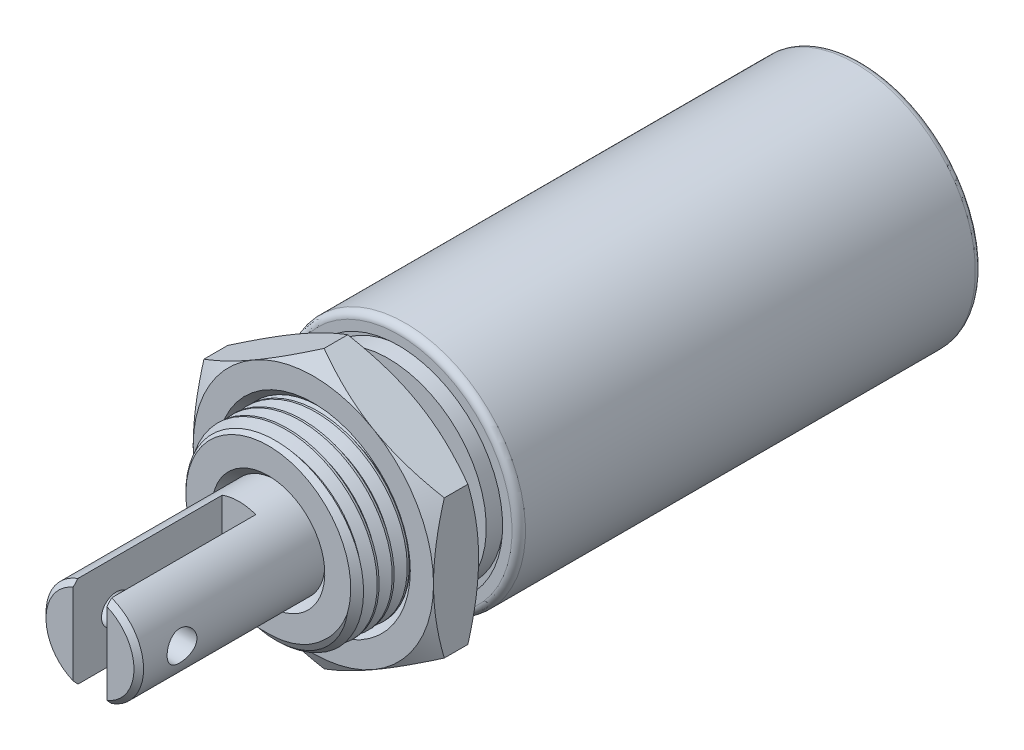
from build123d import *

# Parameters (mm, degrees)
CUT_EXTRUDE1_REACH                  = 28.701
CUT_EXTRUDE1_END_RADIUS             = 2.5781
SKETCH4_W                           = 7.874
SKETCH4_H                           = 1.778
CUT_EXTRUDE1_DIRECTION_2_REACH      = 28.701
CUT_EXTRUDE1_DIRECTION_2_END_RADIUS = 2.5781
CUT_EXTRUDE2_REACH                  = 28.701
CUT_EXTRUDE2_END_RADIUS             = 2.5781
SKETCH5_R                           = 0.7874
CUT_EXTRUDE2_DIRECTION_2_REACH      = 28.701
CUT_EXTRUDE2_DIRECTION_2_END_RADIUS = 2.5781
BOSS_EXTRUDE3_START                 = 1.5875
SKETCH10_R                          = 4.7625
BOSS_EXTRUDE3_DEPTH                 = 2.38125
CUT_SWEEP1_PITCH                    = 0.79375


with BuildPart() as part:
    # Sketch1 → Revolve1 (revolve)
    with BuildSketch(Plane(origin=(0, 0, 0), x_dir=(0, 0, -1), z_dir=(1, 0, 0)), mode=Mode.PRIVATE) as revolve1_sk:
        with BuildLine():
            Line((24.6634, 6.35), (0.889, 6.35))
            ThreePointArc((0.889, 6.35), (0.637552829, 6.245847171), (0.5334, 5.9944))
            Line((0.5334, 5.9944), (0.5334, 5.4991))
            Line((0.5334, 5.4991), (0.9144, 5.4991))
            Line((0.9144, 5.4991), (0.9144, 5.1689))
            Line((0.9144, 5.1689), (0, 5.1689))
            Line((0, 5.1689), (0, 0))
            Line((0, 0), (25.146, 0))
            Line((25.146, 0), (25.146, 2.7432))
            ThreePointArc((25.146, 2.7432), (25.108802561, 2.833002561), (25.019, 2.8702))
            Line((25.019, 2.8702), (25.019, 5.9944))
            ThreePointArc((25.019, 5.9944), (24.914847171, 6.245847171), (24.6634, 6.35))
        make_face()
    revolve(revolve1_sk.sketch.rotate(Axis((0, 0, -25.146), (0, 0, 1)), 90), axis=Axis((0, 0, -25.146), (0, 0, 1)))

    # Sketch2 → Revolve2 (revolve)
    with BuildSketch(Plane(origin=(0, 0, 0), x_dir=(0, 0, -1), z_dir=(1, 0, 0))):
        Polygon((-6.35, 2.9845), (-6.35, 4.3561), (-5.9436, 4.7625), (-1.273939151, 4.7625), (-0.8382, 4.1402), (0, 4.1402), (0, 2.5781), (-5.9436, 2.5781), align=None)
    revolve(axis=Axis((0, 0, 0), (0, 0, 1)))

    # Cut-Sweep1: the profile of Sketch7 screwed along a right-hand helix of 7.944 turns, 8 arcs to a turn; built about Z, then put on its axis
    cut_sweep1_z = Axis((0, 0, 0), (0, 0, 1))
    cut_sweep1_corners = [(4.246944252, 0, -0.396875), (4.246944252, 0, -0.29765625), (4.805462979, 0, 0.024804688), (4.805462979, 0, -0.719335938)]
    with BuildLine(mode=Mode.PRIVATE) as cut_sweep1_profile:
        Line(cut_sweep1_corners[0], cut_sweep1_corners[1])
        Line(cut_sweep1_corners[1], cut_sweep1_corners[2])
        Line(cut_sweep1_corners[2], cut_sweep1_corners[3])
        Line(cut_sweep1_corners[3], cut_sweep1_corners[0])
    cut_sweep1_cap = Face(cut_sweep1_profile.wire())
    cut_sweep1_turn_angles = [0, 22.5, 45, 67.5, 90, 112.5, 135, 157.5, 180, 202.5, 225, 247.5, 270, 292.5, 315, 337.5, 360]
    cut_sweep1_turn_weights = [1, 0.9238795325112867, 1, 0.9238795325112867, 1, 0.9238795325112867, 1, 0.9238795325112867, 1, 0.9238795325112867, 1, 0.9238795325112867, 1, 0.9238795325112867, 1, 0.9238795325112867, 1]
    cut_sweep1_turn_rails = [Edge.make_bspline([Vector(p[0], p[1], 0).rotate(cut_sweep1_z, cut_sweep1_turn_angles[k]) / cut_sweep1_turn_weights[k] + Vector(0, 0, p[2] + CUT_SWEEP1_PITCH * cut_sweep1_turn_angles[k] / 360) for k in range(17)], [0, 0, 0, 1, 1, 2, 2, 3, 3, 4, 4, 5, 5, 6, 6, 7, 7, 8, 8, 8], 2, cut_sweep1_turn_weights) for p in cut_sweep1_corners]
    cut_sweep1_turn_sides = [Face.make_surface_from_curves(cut_sweep1_turn_rails[p[0]], cut_sweep1_turn_rails[p[1]]) for p in [(0, 1), (1, 2), (2, 3), (3, 0)]]
    cut_sweep1_last_angles = [2520, 2542.5, 2565, 2587.5, 2610, 2632.5, 2655, 2677.5, 2700, 2722.5, 2745, 2767.5, 2790, 2812.5, 2835, 2847.42, 2859.84]
    cut_sweep1_last_weights = [1, 0.9238795325112867, 1, 0.9238795325112867, 1, 0.9238795325112867, 1, 0.9238795325112867, 1, 0.9238795325112867, 1, 0.9238795325112867, 1, 0.9238795325112867, 1, 0.976597262063785, 1]
    cut_sweep1_last_rails = [Edge.make_bspline([Vector(p[0], p[1], 0).rotate(cut_sweep1_z, cut_sweep1_last_angles[k]) / cut_sweep1_last_weights[k] + Vector(0, 0, p[2] + CUT_SWEEP1_PITCH * cut_sweep1_last_angles[k] / 360) for k in range(17)], [0, 0, 0, 1, 1, 2, 2, 3, 3, 4, 4, 5, 5, 6, 6, 7, 7, 8, 8, 8], 2, cut_sweep1_last_weights) for p in cut_sweep1_corners]
    cut_sweep1_last_sides = [Face.make_surface_from_curves(cut_sweep1_last_rails[p[0]], cut_sweep1_last_rails[p[1]]) for p in [(0, 1), (1, 2), (2, 3), (3, 0)]]
    cut_sweep1 = Plane(origin=(0, 0, 6.35), x_dir=(0, 1, 0), z_dir=(0, 0, -1)) * Solid(Shell([*[p.moved(Location((0, 0, CUT_SWEEP1_PITCH * i))) for i in range(7) for p in cut_sweep1_turn_sides], *cut_sweep1_last_sides, cut_sweep1_cap, cut_sweep1_cap.rotate(cut_sweep1_z, 2859.84).moved(Location((0, 0, CUT_SWEEP1_PITCH * 2859.84 / 360)))]))
    add(cut_sweep1, mode=Mode.SUBTRACT)


with BuildPart() as body_2:
    # Sketch3 → Revolve3 (revolve)
    with BuildSketch(Plane(origin=(0, 0, 0), x_dir=(0, 0, -1), z_dir=(1, 0, 0))):
        Polygon((-15.5194, 2.5781), (-15.7734, 2.3241), (-15.7734, 0), (0, 0), (0, 2.5781), align=None)
    revolve(axis=Axis((0, 0, 0), (0, 0, 1)))

    # Cut-Extrude1: up to this cylinder (the profile starts inside it)
    cut_extrude1_end = Plane(origin=(0, 0, 11.8364), z_dir=(0, 0, -1)) * Cylinder(CUT_EXTRUDE1_END_RADIUS, 63.5582, mode=Mode.PRIVATE)
    # Sketch4 → Cut-Extrude1 (cut, up to the surface)
    with BuildSketch(Plane(origin=(0, 0, 0), x_dir=(0, 0, -1), z_dir=(0, 1, 0)), mode=Mode.PRIVATE) as cut_extrude1_sk1:
        with Locations((-11.8364, 0)):
            Rectangle(SKETCH4_W, SKETCH4_H)
    cut_extrude1_tool1 = extrude(cut_extrude1_sk1.sketch, amount=-CUT_EXTRUDE1_REACH, mode=Mode.PRIVATE) & cut_extrude1_end
    add(cut_extrude1_tool1.solids().sort_by_distance((0, 0, 11.8364))[0], mode=Mode.SUBTRACT)

    # Cut-Extrude1 direction 2: up to this cylinder (the profile starts inside it)
    cut_extrude1_direction_2_end = Plane(origin=(0, 0, 11.8364), z_dir=(0, 0, -1)) * Cylinder(CUT_EXTRUDE1_DIRECTION_2_END_RADIUS, 63.5582, mode=Mode.PRIVATE)
    # Sketch4 → Cut-Extrude1 direction 2 (cut, up to the surface)
    with BuildSketch(Plane(origin=(0, 0, 0), x_dir=(0, 0, -1), z_dir=(0, 1, 0)), mode=Mode.PRIVATE) as cut_extrude1_direction_2_sk1:
        with Locations((-11.8364, 0)):
            Rectangle(SKETCH4_W, SKETCH4_H)
    cut_extrude1_direction_2_tool1 = extrude(cut_extrude1_direction_2_sk1.sketch, amount=CUT_EXTRUDE1_DIRECTION_2_REACH, mode=Mode.PRIVATE) & cut_extrude1_direction_2_end
    add(cut_extrude1_direction_2_tool1.solids().sort_by_distance((0, 0, 11.8364))[0], mode=Mode.SUBTRACT)

    # Cut-Extrude2: up to this cylinder (the profile starts inside it)
    cut_extrude2_end = Plane(origin=(0, 0, 13.4874), z_dir=(0, 0, -1)) * Cylinder(CUT_EXTRUDE2_END_RADIUS, 63.5582, mode=Mode.PRIVATE)
    # Sketch5 → Cut-Extrude2 (cut, up to the surface)
    with BuildSketch(Plane(origin=(0, 0, 0), x_dir=(0, -1, 0), z_dir=(1, 0, 0)), mode=Mode.PRIVATE) as cut_extrude2_sk1:
        with Locations(Location((0, -13.4874, 0), (0, 0, 270))):
            Circle(SKETCH5_R)
    cut_extrude2_tool1 = extrude(cut_extrude2_sk1.sketch, amount=CUT_EXTRUDE2_REACH, mode=Mode.PRIVATE) & cut_extrude2_end
    add(cut_extrude2_tool1.solids().sort_by_distance((0, 0, 13.4874))[0], mode=Mode.SUBTRACT)

    # Cut-Extrude2 direction 2: up to this cylinder (the profile starts inside it)
    cut_extrude2_direction_2_end = Plane(origin=(0, 0, 13.4874), z_dir=(0, 0, -1)) * Cylinder(CUT_EXTRUDE2_DIRECTION_2_END_RADIUS, 63.5582, mode=Mode.PRIVATE)
    # Sketch5 → Cut-Extrude2 direction 2 (cut, up to the surface)
    with BuildSketch(Plane(origin=(0, 0, 0), x_dir=(0, -1, 0), z_dir=(1, 0, 0)), mode=Mode.PRIVATE) as cut_extrude2_direction_2_sk1:
        with Locations(Location((0, -13.4874, 0), (0, 0, 270))):
            Circle(SKETCH5_R)
    cut_extrude2_direction_2_tool1 = extrude(cut_extrude2_direction_2_sk1.sketch, amount=-CUT_EXTRUDE2_DIRECTION_2_REACH, mode=Mode.PRIVATE) & cut_extrude2_direction_2_end
    add(cut_extrude2_direction_2_tool1.solids().sort_by_distance((0, 0, 13.4874))[0], mode=Mode.SUBTRACT)


with BuildPart() as body_3:
    # Body-Move/Copy1: copy of body 2
    add(body_2.part.moved(Location((0, 0, 6.35))))


with BuildPart() as body_3_2:
    # Sketch10 → Boss-Extrude3 (new body)
    with BuildSketch(Plane.XY.offset(BOSS_EXTRUDE3_START)):
        Polygon((0, 7.332348419), (-6.35, 3.666174209), (-6.35, -3.666174209), (0, -7.332348419), (6.35, -3.666174209), (6.35, 3.666174209), align=None)
        with Locations(Location((0, 0, 0), (0, 0, 180))):
            Circle(SKETCH10_R, mode=Mode.SUBTRACT)
    extrude(amount=BOSS_EXTRUDE3_DEPTH)

    # Sketch11 → Cut-Revolve1 (revolve, cut)
    with BuildSketch(Plane(origin=(0, 0, 0), x_dir=(0, 0, -1), z_dir=(1, 0, 0)), mode=Mode.PRIVATE) as cut_revolve1_sk:
        Polygon((-3.96875, 6.35), (-3.96875, 7.332348419), (-3.401590876, 7.332348419), align=None)
        Polygon((-1.5875, 7.332348419), (-2.154659124, 7.332348419), (-1.5875, 6.35), align=None)
        Polygon((-3.96875, 4.7625), (-3.96875, 5.122480424), (-3.608769576, 4.7625), align=None)
        Polygon((-1.5875, 4.7625), (-1.947480424, 4.7625), (-1.5875, 5.122480424), align=None)
    revolve(cut_revolve1_sk.sketch.rotate(Axis((0, 0, 3.96875), (0, 0, -1)), 90), axis=Axis((0, 0, 3.96875), (0, 0, -1)), mode=Mode.SUBTRACT)


solid = Compound([part.part, body_2.part, body_3_2.part])
